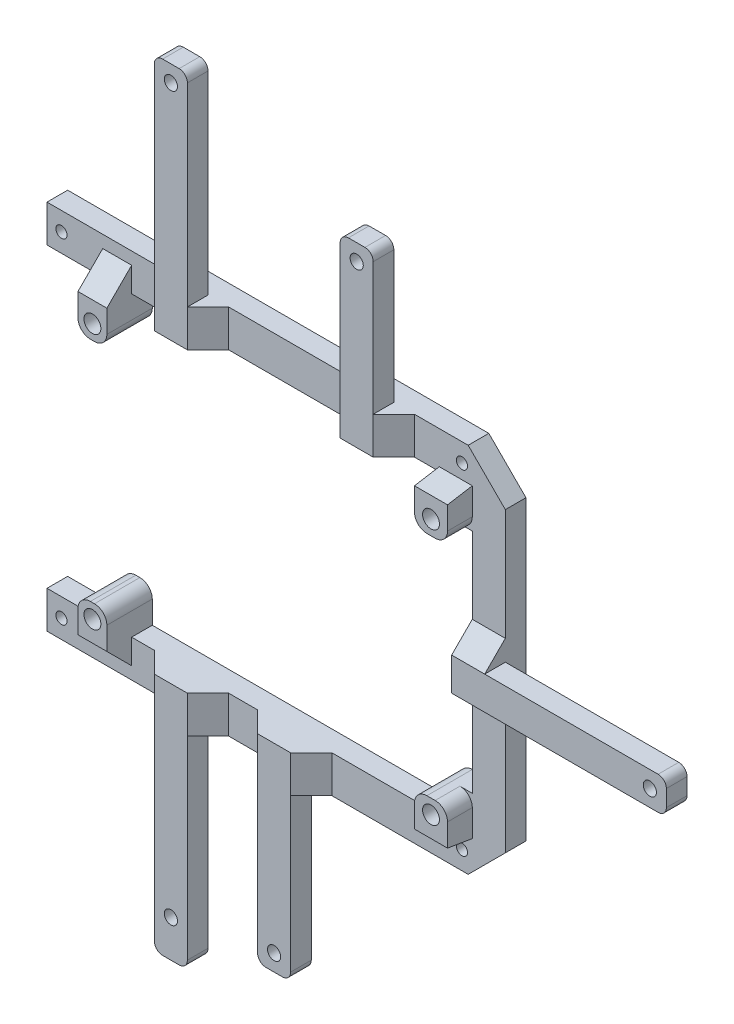
from build123d import *

# Parameters (mm, degrees)
SKETCH2_R           = 1.35
BOSS_EXTRUDE2_DEPTH = 5
BOSS_EXTRUDE3_START = -5
SKETCH3_W           = 7
SKETCH3_H           = 8.5
SKETCH3_R           = 2.05
SKETCH3_W_2         = 8
BOSS_EXTRUDE3_DEPTH = 11
FILLET1_R           = 3
CHAMFER1_SIZE       = 6
CHAMFER2_SIZE2      = 6
CHAMFER2_SIZE       = 1
FILLET2_R           = 3
CHAMFER4_SIZE       = 6
CHAMFER5_SIZE2      = 6
CHAMFER5_SIZE       = 1
SKETCH4_W           = 8
SKETCH4_H           = 9
BOSS_EXTRUDE4_DEPTH = 8
SKETCH5_R           = 2.05
CUT_EXTRUDE1_DEPTH  = 9
SKETCH6_W           = 8
SKETCH6_H           = 8
BOSS_EXTRUDE5_DEPTH = 8
SKETCH7_R           = 2.05
CUT_EXTRUDE2_DEPTH  = 8
SKETCH8_W           = 8
SKETCH8_H           = 9
SKETCH8_H_2         = 8
CUT_EXTRUDE4_DEPTH  = 8
SKETCH9_W           = 8
SKETCH9_H           = 58
SKETCH9_H_2         = 43
SKETCH9_H_3         = 48
SKETCH9_W_2         = 52
SKETCH9_H_4         = 8
BOSS_EXTRUDE6_DEPTH = 5
SKETCH10_R          = 1.6
CUT_EXTRUDE5_DEPTH  = 153.761251631
FILLET3_R           = 2
CHAMFER6_SIZE       = 5


# Some blends are built 0.0001 mm under size
with BuildPart() as part:
    # Sketch2 → Boss-Extrude2 (new body)
    with BuildSketch(Plane.XY):
        Polygon((-35, -45), (67, -45), (76, -36), (76, 36), (67, 45), (-35, 45), (-35, 36), (68, 36), (68, -36), (-35, -36), align=None)
        with Locations((-31.5, -40.5)):
            Circle(SKETCH2_R, mode=Mode.SUBTRACT)
        with Locations((-31.5, 40.5)):
            Circle(SKETCH2_R, mode=Mode.SUBTRACT)
        with Locations((65.5, 40.5)):
            Circle(SKETCH2_R, mode=Mode.SUBTRACT)
        with Locations((65.5, -40.5)):
            Circle(SKETCH2_R, mode=Mode.SUBTRACT)
    extrude(amount=BOSS_EXTRUDE2_DEPTH)

    # Sketch3 → Boss-Extrude3 (add)
    # profile 1 of 2: a face of its own
    with BuildSketch(Plane.XY.offset(5).offset(BOSS_EXTRUDE3_START)):
        with Locations((-18, -31.75)):
            Rectangle(SKETCH3_W, SKETCH3_H)
        with Locations((-18, -31)):
            Circle(SKETCH3_R, mode=Mode.SUBTRACT)
    # profile 2 of 2: a face of its own
    with BuildSketch(Plane.XY.offset(5).offset(BOSS_EXTRUDE3_START)):
        with Locations((64, -31.75)):
            Rectangle(SKETCH3_W_2, SKETCH3_H)
        with Locations((64, -31)):
            Circle(SKETCH3_R, mode=Mode.SUBTRACT)
    boss_extrude3 = extrude(amount=BOSS_EXTRUDE3_DEPTH)

    # Fillet1
    fillet1_edges = [part.edges().sort_by_distance(p)[0] for p in [
        (-21.5, -27.5, 5.5),
        (-14.5, -27.5, 5.5),
        (68, -27.5, 8),
        (60, -27.5, 5.5),
    ]]
    fillet(fillet1_edges, radius=FILLET1_R)

    # Chamfer1
    chamfer1_edges = [part.edges().sort_by_distance(p)[0] for p in [
        (-18, -36, 5),
    ]]
    chamfer(chamfer1_edges, length=CHAMFER1_SIZE - 0.0001)  # a hair under: the kernel refuses the full size

    # Chamfer2
    chamfer2_edges = [part.edges().sort_by_distance(p)[0] for p in [
        (64, -36, 5),
    ]]
    chamfer2_side = [part.faces().sort_by_distance(p)[0] for p in [
        (64, -36.02, 5),
    ]]
    chamfer(chamfer2_edges, length=CHAMFER2_SIZE - 0.0001, length2=CHAMFER2_SIZE2 - 0.0001, reference=chamfer2_side[0])  # a hair under: the kernel refuses the full size

    # Mirror5: Boss-Extrude3 across plane
    add(boss_extrude3.mirror(Plane(origin=(0, 0, 0), x_dir=(0, 0, 1), z_dir=(0, -1, 0))))

    # Fillet2
    fillet2_edges = [part.edges().sort_by_distance(p)[0] for p in [
        (-21.5, 27.5, 5.5),
        (-14.5, 27.5, 5.5),
        (68, 27.5, 8),
        (60, 27.5, 5.5),
    ]]
    fillet(fillet2_edges, radius=FILLET2_R)

    # Chamfer4
    chamfer4_edges = [part.edges().sort_by_distance(p)[0] for p in [
        (-18, 36, 5),
    ]]
    chamfer(chamfer4_edges, length=CHAMFER4_SIZE - 0.0001)  # a hair under: the kernel refuses the full size

    # Chamfer5
    chamfer5_edges = [part.edges().sort_by_distance(p)[0] for p in [
        (64, 36, 5),
    ]]
    chamfer5_side = [part.faces().sort_by_distance(p)[0] for p in [
        (64, 36.02, 5),
    ]]
    chamfer(chamfer5_edges, length=CHAMFER5_SIZE - 0.0001, length2=CHAMFER5_SIZE2 - 0.0001, reference=chamfer5_side[0])  # a hair under: the kernel refuses the full size

    # Sketch4 → Boss-Extrude4 (add)
    with BuildSketch(Plane.XY.offset(5)):
        with Locations((-1, -40.5)):
            Rectangle(SKETCH4_W, SKETCH4_H)
        with Locations((32, -40.5)):
            Rectangle(SKETCH4_W, SKETCH4_H)
    boss_extrude4 = extrude(amount=BOSS_EXTRUDE4_DEPTH)

    # Sketch5 → Cut-Extrude1 (cut)
    with BuildSketch(Plane.XZ.offset(45)):
        with Locations(Location((-1, 9.5, 0), (0, 0, 270))):
            Circle(SKETCH5_R)
        with Locations(Location((32, 9.5, 0), (0, 0, 270))):
            Circle(SKETCH5_R)
    cut_extrude1 = extrude(amount=-CUT_EXTRUDE1_DEPTH, mode=Mode.SUBTRACT)

    # Mirror6: Boss-Extrude4, Cut-Extrude1 across plane
    add(boss_extrude4.mirror(Plane(origin=(0, 0, 0), x_dir=(0, 0, 1), z_dir=(0, -1, 0))))
    add(cut_extrude1.mirror(Plane(origin=(0, 0, 0), x_dir=(0, 0, 1), z_dir=(0, -1, 0))), mode=Mode.SUBTRACT)

    # Sketch6 → Boss-Extrude5 (add)
    with BuildSketch(Plane.XY.offset(5)):
        with Locations((72, 0)):
            Rectangle(SKETCH6_W, SKETCH6_H)
    extrude(amount=BOSS_EXTRUDE5_DEPTH)

    # Sketch7 → Cut-Extrude2 (cut)
    with BuildSketch(Plane(origin=(76, 0, 0), x_dir=(0, 0, -1), z_dir=(1, 0, 0))):
        with Locations(Location((-9.5, 0, 0), (0, 0, 90))):
            Circle(SKETCH7_R)
    extrude(amount=-CUT_EXTRUDE2_DEPTH, mode=Mode.SUBTRACT)

    # Sketch8 → Cut-Extrude4 (cut)
    with BuildSketch(Plane.XY.offset(5)):
        with Locations((-1, -40.5)):
            Rectangle(SKETCH8_W, SKETCH8_H)
        with Locations((32, -40.5)):
            Rectangle(SKETCH8_W, SKETCH8_H)
        with Locations((72, 0)):
            Rectangle(SKETCH8_W, SKETCH8_H_2)
        with Locations((32, 40.5)):
            Rectangle(SKETCH8_W, SKETCH8_H)
        with Locations((-1, 40.5)):
            Rectangle(SKETCH8_W, SKETCH8_H)
    extrude(amount=CUT_EXTRUDE4_DEPTH, mode=Mode.SUBTRACT)

    # Sketch9 → Boss-Extrude6 (add)
    with BuildSketch(Plane.XY.offset(5)):
        with Locations((0, -65)):
            Rectangle(SKETCH9_W, SKETCH9_H)
        with Locations((0, 65)):
            Rectangle(SKETCH9_W, SKETCH9_H)
        with Locations((45, 57.5)):
            Rectangle(SKETCH9_W, SKETCH9_H_2)
        with Locations((25, -60)):
            Rectangle(SKETCH9_W, SKETCH9_H_3)
        with Locations((94, 0)):
            Rectangle(SKETCH9_W_2, SKETCH9_H_4)
    extrude(amount=BOSS_EXTRUDE6_DEPTH)

    # Sketch10 → Cut-Extrude5 (cut, through all)
    with BuildSketch(Plane.XY.offset(10)):
        with Locations((0, -85)):
            Circle(SKETCH10_R)
        with Locations((0, 90)):
            Circle(SKETCH10_R)
        with Locations((45, 75)):
            Circle(SKETCH10_R)
        with Locations((116, 0)):
            Circle(SKETCH10_R)
        with Locations((25, -80)):
            Circle(SKETCH10_R)
    extrude(amount=-CUT_EXTRUDE5_DEPTH, mode=Mode.SUBTRACT)

    # Fillet3
    fillet3_edges = [part.edges().sort_by_distance(p)[0] for p in [
        (-4, -94, 7.5),
        (4, -94, 7.5),
        (-4, 94, 7.5),
        (4, 94, 7.5),
        (41, 79, 7.5),
        (49, 79, 7.5),
        (21, -84, 7.5),
        (29, -84, 7.5),
        (120, -4, 7.5),
        (120, 4, 7.5),
    ]]
    fillet(fillet3_edges, radius=FILLET3_R)

    # Chamfer6
    # the kernel refuses this chamfer: 5 mm, written as the material it adds along each edge
    with BuildSketch(Plane(origin=(21, -45, 5), x_dir=(-0.9996219169112968, 0, -0.027495876610586317), z_dir=(0, 1, 0)), Plane(origin=(-4, -45, 5), x_dir=(-0.9996219169112968, 0, -0.027495876610586327), z_dir=(0, 1, 0)), Plane(origin=(4, -36, 5), x_dir=(0.9996219169112968, 0, -0.027495876610586317), z_dir=(0, -1, 0)), Plane(origin=(29, -36, 5), x_dir=(0.9996219169112968, 0, -0.027495876610586337), z_dir=(0, -1, 0)), Plane(origin=(49, 36, 5), x_dir=(-0.027495876610586317, 0, 0.9996219169112968), z_dir=(0, 1, 0)), Plane(origin=(-4, 45, 5), x_dir=(0.027495876610586317, 0, 0.9996219169112968), z_dir=(0, -1, 0)), Plane(origin=(4, 36, 5), x_dir=(-0.027495876610586403, 0, 0.9996219169112968), z_dir=(0, 1, 0))) as chamfer6_piece_1:
        Polygon((CHAMFER6_SIZE * 0.999621916911, CHAMFER6_SIZE * 0.0274958766106), (-CHAMFER6_SIZE * 0.0274958766106, CHAMFER6_SIZE * 0.999621916911), (0, 0), align=None)
    extrude(amount=9)
    with BuildSketch(Plane(origin=(68, 4, 5), x_dir=(0, 0.9996219169112968, -0.027495876610586324), z_dir=(1, 0, 0)), Plane(origin=(76, -4, 5), x_dir=(0, -0.9996219169112968, -0.027495876610586324), z_dir=(-1, 0, 0))) as chamfer6_piece_2:
        Polygon((CHAMFER6_SIZE * 0.999621916911, CHAMFER6_SIZE * 0.0274958766106), (-CHAMFER6_SIZE * 0.0274958766106, CHAMFER6_SIZE * 0.999621916911), (0, 0), align=None)
    extrude(amount=8)
    with BuildSketch(Plane(origin=(41, 45, 5), x_dir=(-0.9996219169112968, 0, -0.027495876610586317), z_dir=(0, -1, 0))) as chamfer6_piece_3:
        Polygon((CHAMFER6_SIZE * 0.999621916911, -CHAMFER6_SIZE * 0.0274958766106), (-CHAMFER6_SIZE * 0.0274958766106, -CHAMFER6_SIZE * 0.999621916911), (0, 0), align=None)
    extrude(amount=9)


solid = part.part
